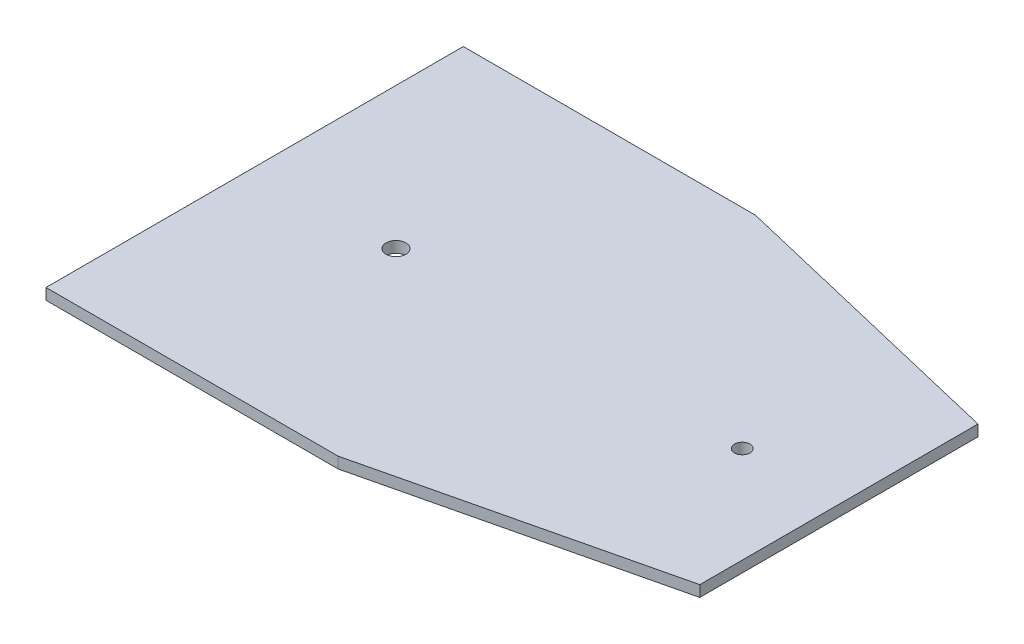
from build123d import *

# Parameters (mm, degrees)
ESBO_O1_R                = 3.571875
ESBO_O1_R_2              = 2.778125
RESSALTO_EXTRUS_O1_DEPTH = 4


with BuildPart() as part:
    # Esboço1 → Ressalto-extrusão1 (new body)
    with BuildSketch(Plane(origin=(0, 0, 0), x_dir=(1, 0, 0), z_dir=(0, 1, 0))):
        Polygon((210, 50), (105, 75), (0, 75), (0, -75), (105, -75), (210, -50), align=None)
        with Locations((50.8, 0)):
            Circle(ESBO_O1_R, mode=Mode.SUBTRACT)
        with Locations((175.26, 0)):
            Circle(ESBO_O1_R_2, mode=Mode.SUBTRACT)
    extrude(amount=RESSALTO_EXTRUS_O1_DEPTH)


solid = part.part
